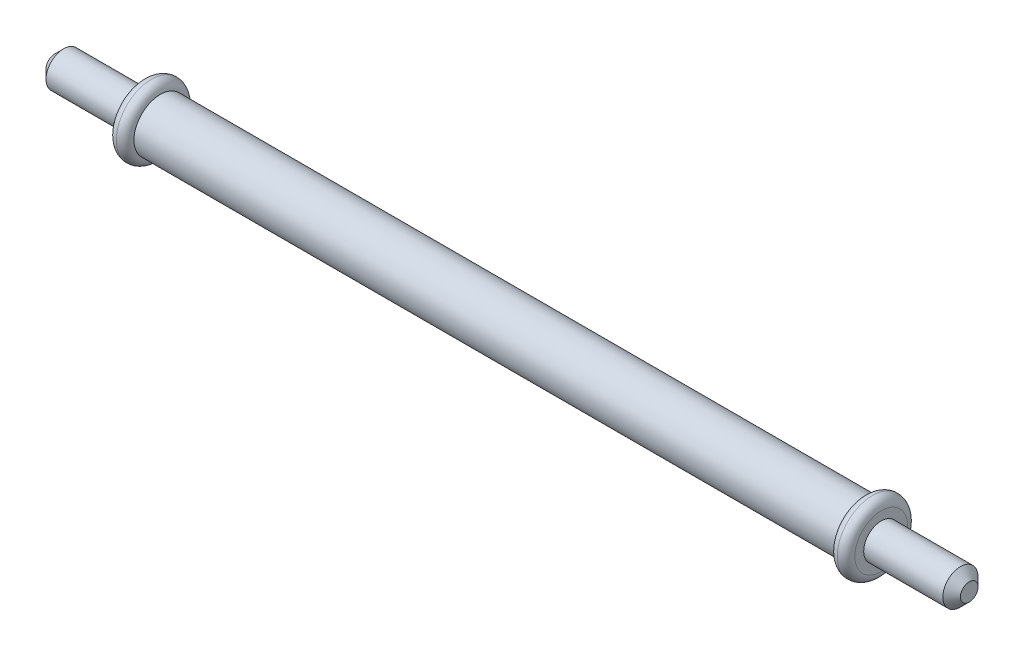
from build123d import *

# Parameters (mm, degrees)
SKETCH2_W           = 10
SKETCH2_H           = 2
SKETCH3_R           = 4
BOSS_EXTRUDE1_DEPTH = 2
FILLET1_R           = 1
CHAMFER1_SIZE       = 1
CHAMFER2_SIZE       = 1
BOSS_EXTRUDE2_START = -2
SKETCH4_R           = 4
BOSS_EXTRUDE2_DEPTH = 2
FILLET2_R           = 1


with BuildPart() as part:
    # Sketch2 → Revolve2 (revolve)
    with BuildSketch(Plane.XY, mode=Mode.PRIVATE) as revolve2_sk:
        with Locations((99, 1)):
            Rectangle(SKETCH2_W, SKETCH2_H)
        Polygon((10, 2), (10, 0), (94, 0), (94, 2), (94, 3), (10, 3), align=None)
        with Locations((5, 1)):
            Rectangle(SKETCH2_W, SKETCH2_H)
    revolve(revolve2_sk.sketch.rotate(Axis((0, 0, 0), (1, 0, 0)), 90), axis=Axis((0, 0, 0), (1, 0, 0)))

    # Sketch3 → Boss-Extrude1 (add)
    with BuildSketch(Plane(origin=(94, 0, 0), x_dir=(0, 0, -1), z_dir=(1, 0, 0))):
        Circle(SKETCH3_R)
    extrude(amount=-BOSS_EXTRUDE1_DEPTH)

    # Fillet1
    fillet1_edges = [part.edges().sort_by_distance(p)[0] for p in [
        (92, 0, 4),
        (94, 0, 4),
    ]]
    fillet(fillet1_edges, radius=FILLET1_R - 0.0001)  # a hair under: the kernel refuses the full size

    # Chamfer1
    chamfer1_edges = [part.edges().sort_by_distance(p)[0] for p in [
        (104, 0, -2),
    ]]
    chamfer(chamfer1_edges, length=CHAMFER1_SIZE)

    # Chamfer2
    chamfer2_edges = [part.edges().sort_by_distance(p)[0] for p in [
        (0, 0, -2),
    ]]
    chamfer(chamfer2_edges, length=CHAMFER2_SIZE)

    # Sketch4 → Boss-Extrude2 (add)
    with BuildSketch(Plane.ZY.offset(-10).offset(BOSS_EXTRUDE2_START)):
        Circle(SKETCH4_R)
    extrude(amount=BOSS_EXTRUDE2_DEPTH)

    # Fillet2
    fillet2_edges = [part.edges().sort_by_distance(p)[0] for p in [
        (12, 0, -4),
        (10, 0, -4),
    ]]
    fillet(fillet2_edges, radius=FILLET2_R - 0.0001)  # a hair under: the kernel refuses the full size


solid = part.part
